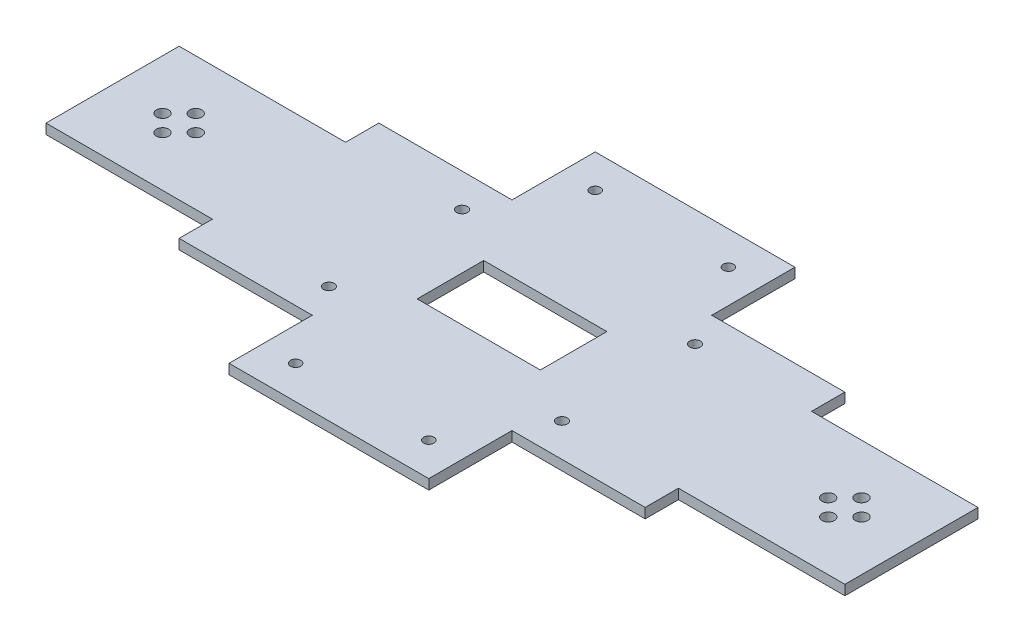
from build123d import *

# Parameters (mm, degrees)
SKETCH1_W           = 37
SKETCH1_H           = 20
SKETCH1_R           = 1.6
SKETCH1_R_2         = 1.85
BOSS_EXTRUDE1_DEPTH = 3
SKETCH2_W           = 60
SKETCH2_H           = 25
SKETCH2_R           = 1.55
BOSS_EXTRUDE2_DEPTH = 3


with BuildPart() as part:
    # Sketch1 → Boss-Extrude1 (new body)
    with BuildSketch(Plane(origin=(0, 0, 0), x_dir=(1, 0, 0), z_dir=(0, 1, 0))):
        Polygon((-70, 30), (-70, 20), (-120, 20), (-120, -20), (-70, -20), (-70, -30), (70, -30), (70, -20), (120, -20), (120, 20), (70, 20), (70, 30), align=None)
        Rectangle(SKETCH1_W, SKETCH1_H, mode=Mode.SUBTRACT)
        with Locations((-35, -20)):
            Circle(SKETCH1_R, mode=Mode.SUBTRACT)
        with Locations((-35, 20)):
            Circle(SKETCH1_R, mode=Mode.SUBTRACT)
        with Locations((35, -20)):
            Circle(SKETCH1_R, mode=Mode.SUBTRACT)
        with Locations((35, 20)):
            Circle(SKETCH1_R, mode=Mode.SUBTRACT)
        with Locations((-100, 5)):
            Circle(SKETCH1_R_2, mode=Mode.SUBTRACT)
        with Locations((-100, -5)):
            Circle(SKETCH1_R_2, mode=Mode.SUBTRACT)
        with Locations((-105, 0)):
            Circle(SKETCH1_R_2, mode=Mode.SUBTRACT)
        with Locations((-95, 0)):
            Circle(SKETCH1_R_2, mode=Mode.SUBTRACT)
        with Locations((100, 5)):
            Circle(SKETCH1_R_2, mode=Mode.SUBTRACT)
        with Locations((100, -5)):
            Circle(SKETCH1_R_2, mode=Mode.SUBTRACT)
        with Locations((95, 0)):
            Circle(SKETCH1_R_2, mode=Mode.SUBTRACT)
        with Locations((105, 0)):
            Circle(SKETCH1_R_2, mode=Mode.SUBTRACT)
    extrude(amount=BOSS_EXTRUDE1_DEPTH)

    # Sketch2 → Boss-Extrude2 (add)
    # profile 1 of 2: a face of its own
    with BuildSketch(Plane(origin=(0, 3, 0), x_dir=(1, 0, 0), z_dir=(0, 1, 0))):
        with Locations((0, 42.5)):
            Rectangle(SKETCH2_W, SKETCH2_H)
        with Locations((-20, 45)):
            Circle(SKETCH2_R, mode=Mode.SUBTRACT)
        with Locations((20, 45)):
            Circle(SKETCH2_R, mode=Mode.SUBTRACT)
    # profile 2 of 2: a face of its own
    with BuildSketch(Plane(origin=(0, 3, 0), x_dir=(1, 0, 0), z_dir=(0, 1, 0))):
        with Locations((0, -42.5)):
            Rectangle(SKETCH2_W, SKETCH2_H)
        with Locations((-20, -45)):
            Circle(SKETCH2_R, mode=Mode.SUBTRACT)
        with Locations((20, -45)):
            Circle(SKETCH2_R, mode=Mode.SUBTRACT)
    extrude(amount=-BOSS_EXTRUDE2_DEPTH)


solid = part.part
